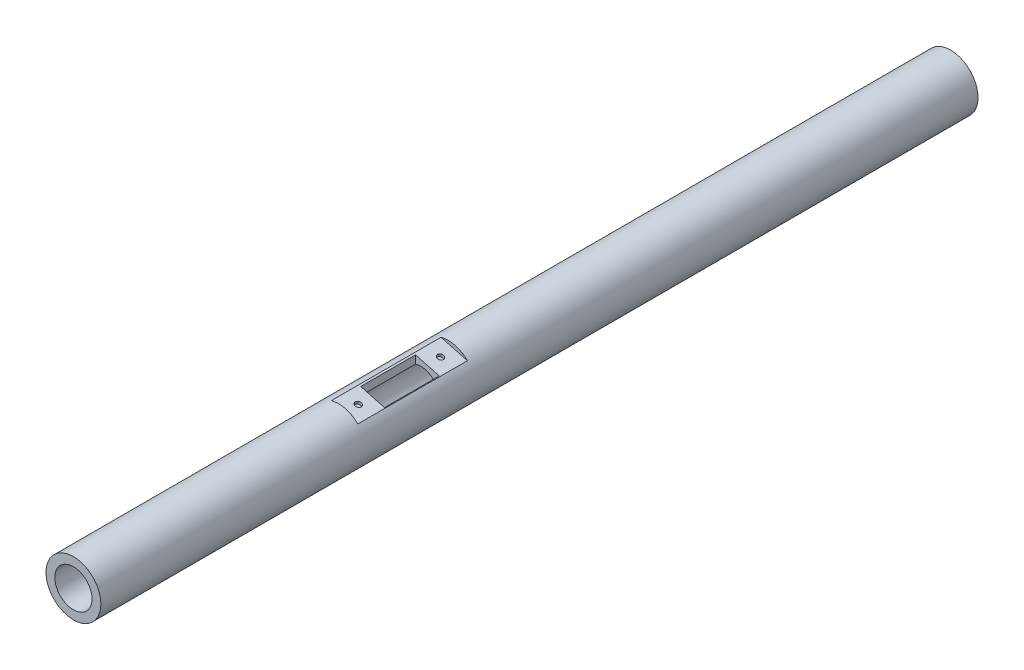
from build123d import *

# Parameters (mm, degrees)
SKETCH2_R                                 = 19.05
SKETCH2_R_2                               = 12.954
BOSS_EXTRUDE1_DEPTH                       = 685.8
CUT_EXTRUDE2_REACH                        = 688.329
SKETCH4_W                                 = 16.51
SKETCH4_H                                 = 38.1
SKETCH7_W                                 = 76.2
SKETCH7_H                                 = 76.2
CUT_EXTRUDE3_DEPTH                        = 2.54
TAP_DRILL_FOR_M5X0_8_TAP1_D               = 4.2
TAP_DRILL_FOR_M5X0_8_TAP1_DEPTH           = 2.032
TAP_DRILL_FOR_M5X0_8_TAP1_TIP             = 1.2618073
TAP_DRILL_FOR_M5X0_8_TAP1_ON_FACE_2_D     = 4.2
TAP_DRILL_FOR_M5X0_8_TAP1_ON_FACE_2_DEPTH = 2.032
TAP_DRILL_FOR_M5X0_8_TAP1_ON_FACE_2_TIP   = 1.2618073
SKETCH6_R                                 = 19.05
CUT_EXTRUDE4_DEPTH                        = 76.2


with BuildPart() as part:
    # Sketch2 → Boss-Extrude1 (new body)
    with BuildSketch(Plane.XY):
        Circle(SKETCH2_R)
        Circle(SKETCH2_R_2, mode=Mode.SUBTRACT)
    extrude(amount=BOSS_EXTRUDE1_DEPTH)

    # Sketch4 → Cut-Extrude2 (cut, up to next)
    with BuildSketch(Plane(origin=(0, 0, 0), x_dir=(1, 0, 0), z_dir=(0, 1, 0)), mode=Mode.PRIVATE) as cut_extrude2_sk1:
        with Locations((4.699, -463.55)):
            Rectangle(SKETCH4_W, SKETCH4_H)
    cut_extrude2_tool1 = extrude(cut_extrude2_sk1.sketch, amount=CUT_EXTRUDE2_REACH, mode=Mode.PRIVATE) & part.part
    add(cut_extrude2_tool1.solids().sort_by_distance((4.699, 0, 463.55))[0], mode=Mode.SUBTRACT)

    # Sketch7 → Cut-Extrude3 (cut)
    with BuildSketch(Plane(origin=(4.930502809, 18.400886991, 0), x_dir=(0, 0, -1), z_dir=(0.25881904510252135, 0.9659258262890681, 0))):
        with Locations((-463.55, -0.309412831)):
            Rectangle(SKETCH7_W, SKETCH7_H)
    extrude(amount=-CUT_EXTRUDE3_DEPTH, mode=Mode.SUBTRACT)

    # Tap Drill for M5x0.8 Tap1
    with Locations(Plane(origin=(4.273102435, 15.947435392, 434.975), x_dir=(0.965925826289, -0.258819045103, 0), z_dir=(0.258819045103, 0.965925826289, 0))):
        with Locations((0, 0)):
            Hole(TAP_DRILL_FOR_M5X0_8_TAP1_D / 2, depth=TAP_DRILL_FOR_M5X0_8_TAP1_DEPTH)
            with Locations((0, 0, -(TAP_DRILL_FOR_M5X0_8_TAP1_DEPTH + TAP_DRILL_FOR_M5X0_8_TAP1_TIP / 2))):  # 118° drill point
                Cone(0, TAP_DRILL_FOR_M5X0_8_TAP1_D / 2, TAP_DRILL_FOR_M5X0_8_TAP1_TIP, mode=Mode.SUBTRACT)

    # Tap Drill for M5x0.8 Tap1 on face 2
    with Locations(Plane(origin=(4.273102435, 15.947435392, 492.125), x_dir=(0.965925849201, -0.258818959594, 0), z_dir=(0.258818959594, 0.965925849201, 0))):
        with Locations((0, 0)):
            Hole(TAP_DRILL_FOR_M5X0_8_TAP1_ON_FACE_2_D / 2, depth=TAP_DRILL_FOR_M5X0_8_TAP1_ON_FACE_2_DEPTH)
            with Locations((0, 0, -(TAP_DRILL_FOR_M5X0_8_TAP1_ON_FACE_2_DEPTH + TAP_DRILL_FOR_M5X0_8_TAP1_ON_FACE_2_TIP / 2))):  # 118° drill point
                Cone(0, TAP_DRILL_FOR_M5X0_8_TAP1_ON_FACE_2_D / 2, TAP_DRILL_FOR_M5X0_8_TAP1_ON_FACE_2_TIP, mode=Mode.SUBTRACT)

    # Sketch6 → Cut-Extrude4 (cut)
    with BuildSketch(Plane(origin=(0, 0, 0), x_dir=(-1, 0, 0), z_dir=(0, 0, -1))):
        Circle(SKETCH6_R)
    extrude(amount=-CUT_EXTRUDE4_DEPTH, mode=Mode.SUBTRACT)


solid = part.part
